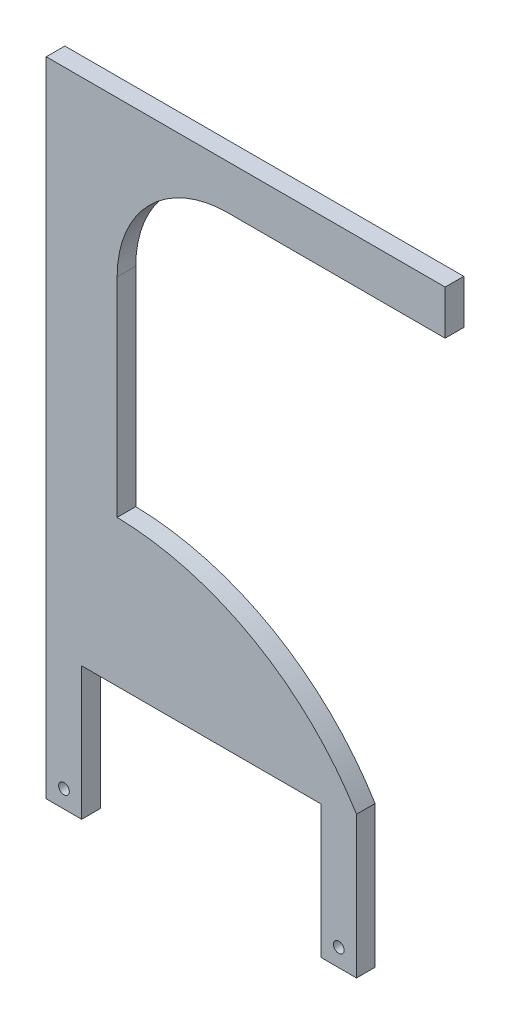
from build123d import *

# Parameters (mm, degrees)
BOSS_EXTRU_1_DEPTH      = 4.2
CONG_2_R                = 25
ESQUISSE2_R             = 1
ENL_V_MAT_EXTRU_5_DEPTH = 10
D_GAGEMENT_M21_D        = 2.4


with BuildPart() as part:
    # Esquisse1 → Boss.-Extru.1 (new body)
    with BuildSketch(Plane.XY):
        with BuildLine():
            Line((0, 145), (90, 145))
            Line((90, 145), (90, 135))
            Line((90, 135), (16, 135))
            Line((16, 135), (16, 63))
            ThreePointArc((16, 63), (46.953476446, 54.386700906), (70, 32))
            Line((70, 32), (70, 0))
            Line((70, 0), (62, 0))
            Line((62, 0), (62, 30))
            Line((62, 30), (8, 30))
            Line((8, 30), (8, 0))
            Line((8, 0), (0, 0))
            Line((0, 0), (0, 145))
        make_face()
    extrude(amount=BOSS_EXTRU_1_DEPTH)

    # Congé2
    cong_2_edges = [part.edges().sort_by_distance(p)[0] for p in [
        (16, 135, 2.1),
    ]]
    fillet(cong_2_edges, radius=CONG_2_R)

    # Esquisse2 → Enlèv. mat.-Extru.5 (cut)
    with BuildSketch(Plane.XY.offset(4.2)):
        with Locations((4, 4)):
            Circle(ESQUISSE2_R)
        with Locations((66, 4)):
            Circle(ESQUISSE2_R)
    extrude(amount=-ENL_V_MAT_EXTRU_5_DEPTH, mode=Mode.SUBTRACT)

    # Dégagement M21 (through all)
    with Locations(Plane.XY.offset(4.2)):
        with Locations((4, 4), (66, 4)):
            Hole(D_GAGEMENT_M21_D / 2)


solid = part.part
